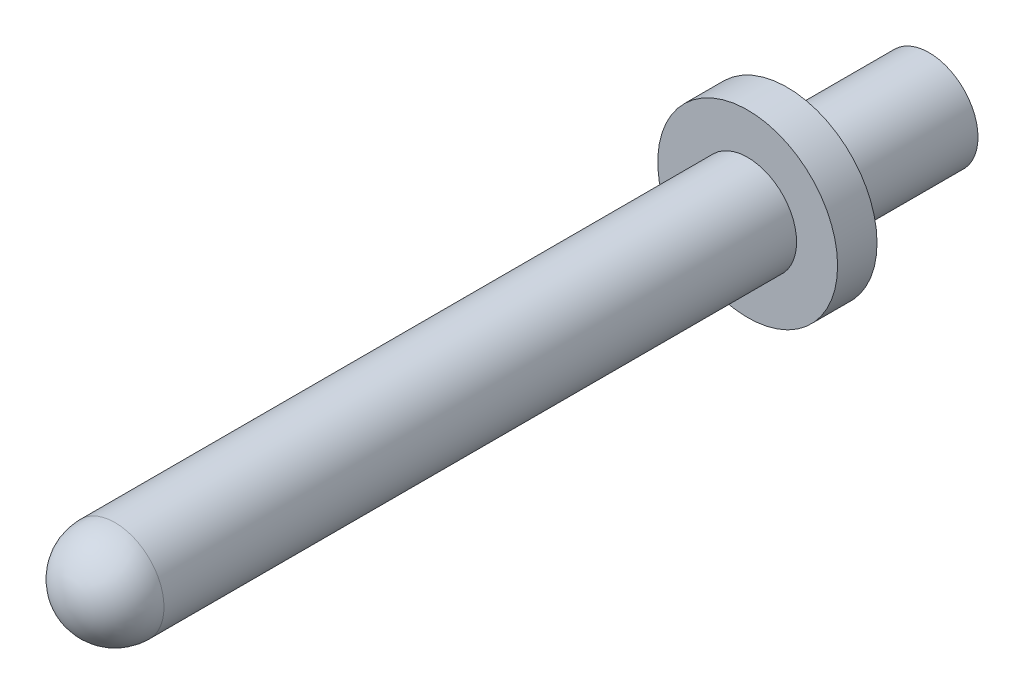
from build123d import *


with BuildPart() as part:
    # Sketch1 → Revolve1 (revolve)
    with BuildSketch(Plane(origin=(0, 0, 0), x_dir=(1, 0, 0), z_dir=(0, 1, 0))):
        with BuildLine():
            Line((1.4478, 11.6078), (0.7874, 11.6078))
            Line((0.7874, 11.6078), (0.7874, 13.8938))
            Line((0.7874, 13.8938), (0.5461, 13.8938))
            Line((0.5461, 13.8938), (0.5461, 11.6078))
            Line((0.5461, 11.6078), (0, 11.2903))
            Line((0, 11.2903), (0, 0))
            ThreePointArc((0, 0), (0.55677588, 0.23062412), (0.7874, 0.7874))
            Line((0.7874, 0.7874), (0.7874, 10.9728))
            Line((0.7874, 10.9728), (1.4478, 10.9728))
            Line((1.4478, 10.9728), (1.4478, 11.6078))
        make_face()
    revolve(axis=Axis((0, 0, 0), (0, 0, -1)))


solid = part.part
